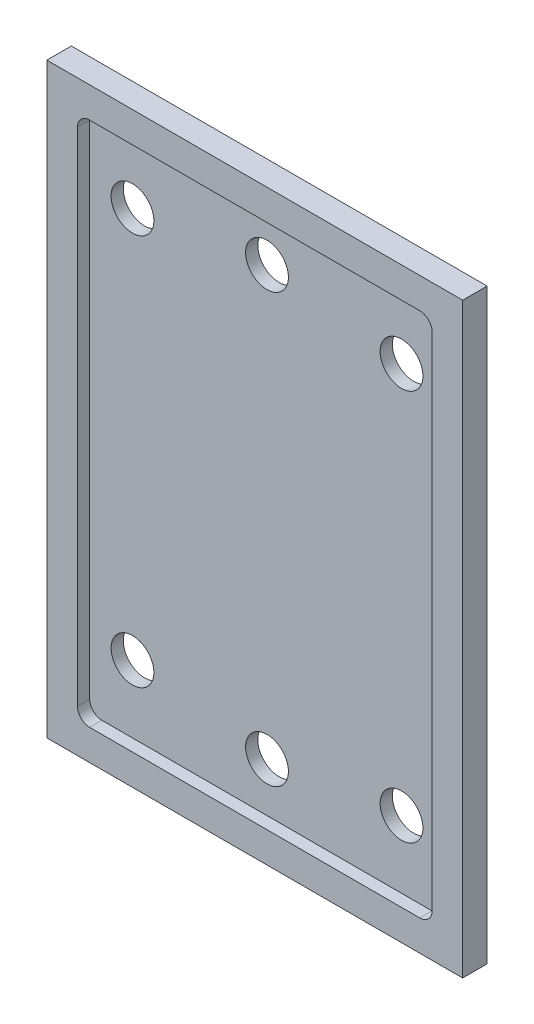
from build123d import *

# Parameters (mm, degrees)
SKETCH1_W           = 215.9
SKETCH1_H           = 304.8
BOSS_EXTRUDE1_DEPTH = 12.7
CUT_EXTRUDE1_DEPTH  = 6.35
SKETCH4_R           = 11.1125
CUT_EXTRUDE2_DEPTH  = 187.867024913


with BuildPart() as part:
    # Sketch1 → Boss-Extrude1 (new body)
    with BuildSketch(Plane.XY):
        Rectangle(SKETCH1_W, SKETCH1_H)
    extrude(amount=BOSS_EXTRUDE1_DEPTH)

    # Sketch2 → Cut-Extrude1 (cut)
    with BuildSketch(Plane.XY.offset(12.7)):
        with BuildLine():
            Line((85.725, -136.525), (-85.725, -136.525))
            ThreePointArc((-85.725, -136.525), (-90.215128061, -134.665128061), (-92.075, -130.175))
            Line((-92.075, -130.175), (-92.075, 130.175))
            ThreePointArc((-92.075, 130.175), (-90.215128061, 134.665128061), (-85.725, 136.525))
            Line((-85.725, 136.525), (85.725, 136.525))
            ThreePointArc((85.725, 136.525), (90.215128061, 134.665128061), (92.075, 130.175))
            Line((92.075, 130.175), (92.075, -130.175))
            ThreePointArc((92.075, -130.175), (90.215128061, -134.665128061), (85.725, -136.525))
        make_face()
    extrude(amount=-CUT_EXTRUDE1_DEPTH, mode=Mode.SUBTRACT)

    # Sketch4 → Cut-Extrude2 (cut, through all)
    with BuildSketch(Plane.XY.offset(6.35)):
        with Locations((-69.85, 101.6)):
            Circle(SKETCH4_R)
        with Locations((69.85, 101.6)):
            Circle(SKETCH4_R)
        with Locations((-69.85, -101.6)):
            Circle(SKETCH4_R)
        with Locations((69.85, -101.6)):
            Circle(SKETCH4_R)
        with Locations((0, 111.125)):
            Circle(SKETCH4_R)
        with Locations((0, -111.125)):
            Circle(SKETCH4_R)
    extrude(amount=-CUT_EXTRUDE2_DEPTH, mode=Mode.SUBTRACT)


solid = part.part
